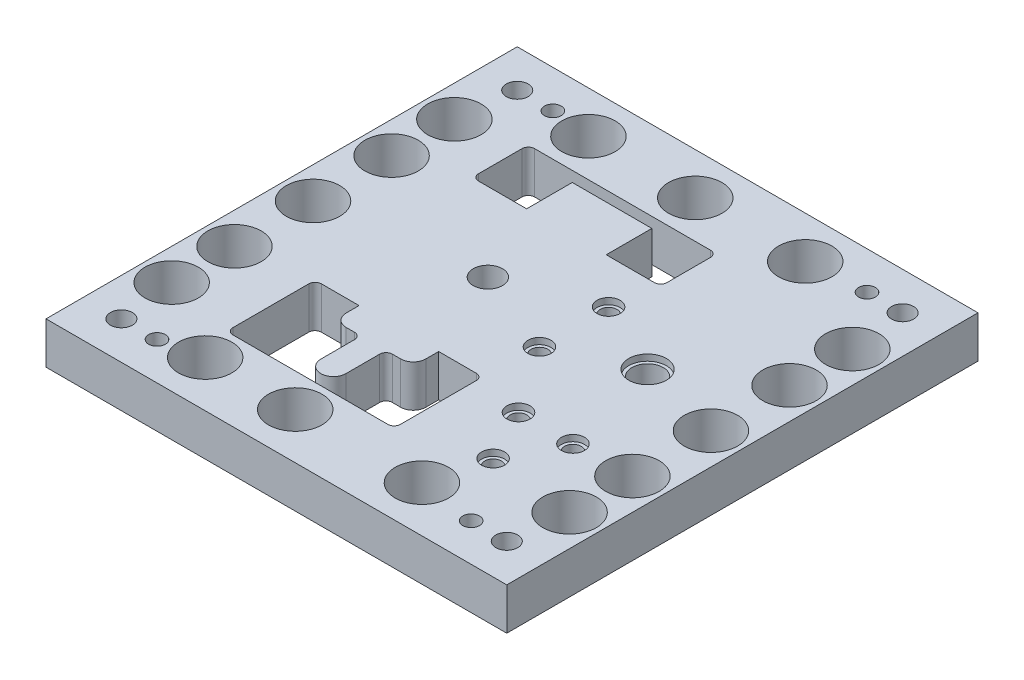
from build123d import *

# Parameters (mm, degrees)
SKETCH1_W                                    = 220
SKETCH1_H                                    = 225
BOSS_EXTRUDE1_DEPTH                          = 20
CUT_EXTRUDE3_REACH                           = 160.607
CUT_EXTRUDE4_REACH                           = 160.607
CUT_EXTRUDE5_REACH                           = 160.607
SKETCH7_R                                    = 4
CUT_EXTRUDE6_REACH                           = 160.607
SKETCH9_R                                    = 7.5
SKETCH10_R                                   = 5.5
CUT_EXTRUDE7_DEPTH                           = 3
SKETCH11_R                                   = 9
CUT_EXTRUDE8_DEPTH                           = 3
CBORE_FOR_M10_HEX_SOCKET_HEAD_CAP_SC_2_COUNT = 2
CBORE_FOR_M10_HEX_SOCKET_HEAD_CAP_SC_2_PITCH = 184
CBORE_FOR_M10_HEX_SOCKET_HEAD_CAP_SC_3_COUNT = 2
CBORE_FOR_M10_HEX_SOCKET_HEAD_CAP_SC_3_PITCH = 263.774524926
CBORE_FOR_M10_HEX_SOCKET_HEAD_CAP_SC_4_COUNT = 2
CBORE_FOR_M10_HEX_SOCKET_HEAD_CAP_SC_4_PITCH = 189
F_8_0MM_DOWEL_HOLE1_D                        = 8
F_25_5_25_5_DIAMETER_HOLE1_D                 = 25.5
CUT_EXTRUDE9_REACH                           = 160.607
SKETCH26_R                                   = 7


with BuildPart() as part:
    # Sketch1 → Boss-Extrude1 (new body)
    with BuildSketch(Plane(origin=(0, 0, 0), x_dir=(1, 0, 0), z_dir=(0, 1, 0))):
        Rectangle(SKETCH1_W, SKETCH1_H)
    extrude(amount=-BOSS_EXTRUDE1_DEPTH)

    # Sketch5 → Cut-Extrude3 (cut, up to next)
    with BuildSketch(Plane(origin=(0, 0, 0), x_dir=(1, 0, 0), z_dir=(0, 1, 0)), mode=Mode.PRIVATE) as cut_extrude3_sk1:
        with BuildLine():
            Line((-2.75, -38.4), (-2.75, -32.27))
            Line((-2.75, -32.27), (15.25, -32.27))
            ThreePointArc((15.25, -32.27), (17.371320344, -33.148679656), (18.25, -35.27))
            Line((18.25, -35.27), (18.25, -71.53))
            ThreePointArc((18.25, -71.53), (17.371320344, -73.651320344), (15.25, -74.53))
            Line((15.25, -74.53), (-58.75, -74.53))
            ThreePointArc((-58.75, -74.53), (-60.871320344, -73.651320344), (-61.75, -71.53))
            Line((-61.75, -71.53), (-61.75, -35.27))
            ThreePointArc((-61.75, -35.27), (-60.871320344, -33.148679656), (-58.75, -32.27))
            Line((-58.75, -32.27), (-40.75, -32.27))
            Line((-40.75, -32.27), (-40.75, -38.4))
            ThreePointArc((-40.75, -38.4), (-38.992640687, -42.642640687), (-34.75, -44.4))
            Line((-34.75, -44.4), (-30.75, -44.4))
            ThreePointArc((-30.75, -44.4), (-28.628679656, -45.278679656), (-27.75, -47.4))
            Line((-27.75, -47.4), (-27.75, -63.53))
            ThreePointArc((-27.75, -63.53), (-21.75, -69.53), (-15.75, -63.53))
            Line((-15.75, -63.53), (-15.75, -47.4))
            ThreePointArc((-15.75, -47.4), (-14.871320344, -45.278679656), (-12.75, -44.4))
            Line((-12.75, -44.4), (-8.75, -44.4))
            ThreePointArc((-8.75, -44.4), (-4.507359313, -42.642640687), (-2.75, -38.4))
        make_face()
    cut_extrude3_tool1 = extrude(cut_extrude3_sk1.sketch, amount=-CUT_EXTRUDE3_REACH, mode=Mode.PRIVATE) & part.part
    add(cut_extrude3_tool1.solids().sort_by_distance((-1.84524, 0, 35.335))[0], mode=Mode.SUBTRACT)

    # Sketch6 → Cut-Extrude4 (cut, up to next)
    with BuildSketch(Plane(origin=(0, 0, 0), x_dir=(1, 0, 0), z_dir=(0, 1, 0)), mode=Mode.PRIVATE) as cut_extrude4_sk1:
        with BuildLine():
            Line((-40.75, 47.73), (-63.75, 47.73))
            ThreePointArc((-63.75, 47.73), (-65.871320344, 48.608679656), (-66.75, 50.73))
            Line((-66.75, 50.73), (-66.75, 71.53))
            ThreePointArc((-66.75, 71.53), (-65.871320344, 73.651320344), (-63.75, 74.53))
            Line((-63.75, 74.53), (20.25, 74.53))
            ThreePointArc((20.25, 74.53), (22.371320344, 73.651320344), (23.25, 71.53))
            Line((23.25, 71.53), (23.25, 50.73))
            ThreePointArc((23.25, 50.73), (22.371320344, 48.608679656), (20.25, 47.73))
            Line((20.25, 47.73), (-2.75, 47.73))
            Line((-2.75, 47.73), (-2.75, 69.53))
            Line((-2.75, 69.53), (-40.75, 69.53))
            Line((-40.75, 69.53), (-40.75, 47.73))
        make_face()
    cut_extrude4_tool1 = extrude(cut_extrude4_sk1.sketch, amount=-CUT_EXTRUDE4_REACH, mode=Mode.PRIVATE) & part.part
    add(cut_extrude4_tool1.solids().sort_by_distance((-52.25, 0, -48.669055))[0], mode=Mode.SUBTRACT)

    # Sketch7 → Cut-Extrude5 (cut, up to next)
    with BuildSketch(Plane(origin=(0, 0, 0), x_dir=(1, 0, 0), z_dir=(0, 1, 0)), mode=Mode.PRIVATE) as cut_extrude5_sk1:
        with Locations((54.5, -63.53)):
            Circle(SKETCH7_R)
    cut_extrude5_tool1 = extrude(cut_extrude5_sk1.sketch, amount=-CUT_EXTRUDE5_REACH, mode=Mode.PRIVATE) & part.part
    # Sketch7 → Cut-Extrude5 (cut, up to next)
    with BuildSketch(Plane(origin=(0, 0, 0), x_dir=(1, 0, 0), z_dir=(0, 1, 0)), mode=Mode.PRIVATE) as cut_extrude5_sk2:
        with Locations((67.5, -38.4)):
            Circle(SKETCH7_R)
    cut_extrude5_tool2 = extrude(cut_extrude5_sk2.sketch, amount=-CUT_EXTRUDE5_REACH, mode=Mode.PRIVATE) & part.part
    # Sketch7 → Cut-Extrude5 (cut, up to next)
    with BuildSketch(Plane(origin=(0, 0, 0), x_dir=(1, 0, 0), z_dir=(0, 1, 0)), mode=Mode.PRIVATE) as cut_extrude5_sk3:
        with Locations((41.5, -38.4)):
            Circle(SKETCH7_R)
    cut_extrude5_tool3 = extrude(cut_extrude5_sk3.sketch, amount=-CUT_EXTRUDE5_REACH, mode=Mode.PRIVATE) & part.part
    # Sketch7 → Cut-Extrude5 (cut, up to next)
    with BuildSketch(Plane(origin=(0, 0, 0), x_dir=(1, 0, 0), z_dir=(0, 1, 0)), mode=Mode.PRIVATE) as cut_extrude5_sk4:
        with Locations((19.38, -6.27)):
            Circle(SKETCH7_R)
    cut_extrude5_tool4 = extrude(cut_extrude5_sk4.sketch, amount=-CUT_EXTRUDE5_REACH, mode=Mode.PRIVATE) & part.part
    # Sketch7 → Cut-Extrude5 (cut, up to next)
    with BuildSketch(Plane(origin=(0, 0, 0), x_dir=(1, 0, 0), z_dir=(0, 1, 0)), mode=Mode.PRIVATE) as cut_extrude5_sk5:
        with Locations((19.38, 26.73)):
            Circle(SKETCH7_R)
    cut_extrude5_tool5 = extrude(cut_extrude5_sk5.sketch, amount=-CUT_EXTRUDE5_REACH, mode=Mode.PRIVATE) & part.part
    add(cut_extrude5_tool1.solids().sort_by_distance((54.5, 0, 63.53))[0], mode=Mode.SUBTRACT)
    add(cut_extrude5_tool2.solids().sort_by_distance((67.5, 0, 38.4))[0], mode=Mode.SUBTRACT)
    add(cut_extrude5_tool3.solids().sort_by_distance((41.5, 0, 38.4))[0], mode=Mode.SUBTRACT)
    add(cut_extrude5_tool4.solids().sort_by_distance((19.38, 0, 6.27))[0], mode=Mode.SUBTRACT)
    add(cut_extrude5_tool5.solids().sort_by_distance((19.38, 0, -26.73))[0], mode=Mode.SUBTRACT)

    # Sketch9 → Cut-Extrude6 (cut, up to next)
    with BuildSketch(Plane(origin=(0, 0, 0), x_dir=(1, 0, 0), z_dir=(0, 1, 0)), mode=Mode.PRIVATE) as cut_extrude6_sk1:
        with Locations((54.5, 10.23)):
            Circle(SKETCH9_R)
    cut_extrude6_tool1 = extrude(cut_extrude6_sk1.sketch, amount=-CUT_EXTRUDE6_REACH, mode=Mode.PRIVATE) & part.part
    add(cut_extrude6_tool1.solids().sort_by_distance((54.5, 0, -10.23))[0], mode=Mode.SUBTRACT)

    # Sketch10 → Cut-Extrude7 (cut)
    with BuildSketch(Plane(origin=(0, 0, 0), x_dir=(1, 0, 0), z_dir=(0, 1, 0))):
        with Locations((19.38, 26.73)):
            Circle(SKETCH10_R)
        with Locations((19.38, -6.27)):
            Circle(SKETCH10_R)
        with Locations((41.5, -38.4)):
            Circle(SKETCH10_R)
        with Locations((67.5, -38.4)):
            Circle(SKETCH10_R)
        with Locations((54.5, -63.53)):
            Circle(SKETCH10_R)
    extrude(amount=-CUT_EXTRUDE7_DEPTH, mode=Mode.SUBTRACT)

    # Sketch11 → Cut-Extrude8 (cut)
    with BuildSketch(Plane(origin=(0, 0, 0), x_dir=(1, 0, 0), z_dir=(0, 1, 0))):
        with Locations((54.5, 10.23)):
            Circle(SKETCH11_R)
    extrude(amount=-CUT_EXTRUDE8_DEPTH, mode=Mode.SUBTRACT)

    # Sketch16 → CBORE for M10 Hex Socket Head Cap Screw1 (revolve, cut)
    with BuildSketch(Plane(origin=(92, -20, -94.5), x_dir=(0, 0, -1), z_dir=(1, 0, 0))):
        Polygon((0, 0), (0, 20), (5.25, 20), (5.25, 10.6), (9, 10.6), (9, 0.025), (9.025, 0), align=None)
    cbore_for_m10_hex_socket_head_cap_screw1 = revolve(axis=Axis((92, -26.35, -94.5), (0, 1, 0)), mode=Mode.SUBTRACT)

    # CBORE for M10 Hex Socket Head Cap Sc 2: CBORE for M10 Hex Socket Head Cap Screw1 ×2
    with Locations(*[(-i * CBORE_FOR_M10_HEX_SOCKET_HEAD_CAP_SC_2_PITCH, 0, 0) for i in range(1, CBORE_FOR_M10_HEX_SOCKET_HEAD_CAP_SC_2_COUNT)]):
        add(cbore_for_m10_hex_socket_head_cap_screw1, mode=Mode.SUBTRACT)

    # CBORE for M10 Hex Socket Head Cap Sc 3: CBORE for M10 Hex Socket Head Cap Screw1 ×2
    with Locations(*[Vector(-0.6975654682783963, 0, 0.7165210516555266) * (i * CBORE_FOR_M10_HEX_SOCKET_HEAD_CAP_SC_3_PITCH) for i in range(1, CBORE_FOR_M10_HEX_SOCKET_HEAD_CAP_SC_3_COUNT)]):
        add(cbore_for_m10_hex_socket_head_cap_screw1, mode=Mode.SUBTRACT)

    # CBORE for M10 Hex Socket Head Cap Sc 4: CBORE for M10 Hex Socket Head Cap Screw1 ×2
    with Locations(*[(0, 0, i * CBORE_FOR_M10_HEX_SOCKET_HEAD_CAP_SC_4_PITCH) for i in range(1, CBORE_FOR_M10_HEX_SOCKET_HEAD_CAP_SC_4_COUNT)]):
        add(cbore_for_m10_hex_socket_head_cap_screw1, mode=Mode.SUBTRACT)

    # Ø8.0mm Dowel Hole1 (through all)
    with Locations(Plane(origin=(0, -20, 0), x_dir=(-1, 0, 0), z_dir=(0, -1, 0))):
        with Locations((-75, 94.5), (75, 94.5), (75, -94.5), (-75, -94.5)):
            Hole(F_8_0MM_DOWEL_HOLE1_D / 2)

    # Ø25.5 (25.5) Diameter Hole1 (through all)
    with Locations(Plane(origin=(0, 0, 0), x_dir=(1, 0, 0), z_dir=(0, 1, 0))):
        with Locations((-56, 92.5), (-5, 92.5), (47.5, 92.5), (95, 67.5), (95, 37.5), (95, 0), (95, -37.5), (95, -67.5), (47.5, -90.5), (-13, -90.5), (-56, -90.5), (-95, -67.5), (-95, -37.5), (-95, 0), (-95, 67.5), (-95, 37.5)):
            Hole(F_25_5_25_5_DIAMETER_HOLE1_D / 2)

    # Sketch26 → Cut-Extrude9 (cut, up to next)
    with BuildSketch(Plane(origin=(0, 0, 0), x_dir=(1, 0, 0), z_dir=(0, 1, 0)), mode=Mode.PRIVATE) as cut_extrude9_sk1:
        with Locations((-21.75, 10.23)):
            Circle(SKETCH26_R)
    cut_extrude9_tool1 = extrude(cut_extrude9_sk1.sketch, amount=-CUT_EXTRUDE9_REACH, mode=Mode.PRIVATE) & part.part
    add(cut_extrude9_tool1.solids().sort_by_distance((-21.75, 0, -10.23))[0], mode=Mode.SUBTRACT)


solid = part.part
